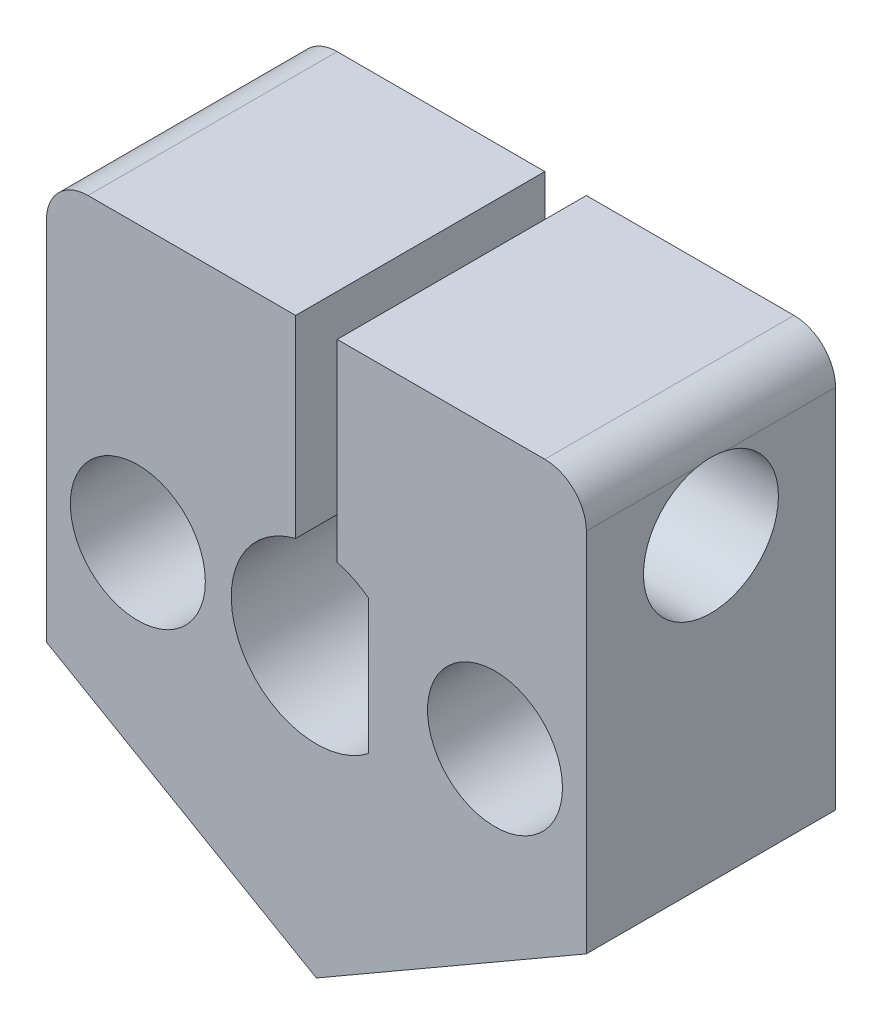
from build123d import *

# Parameters (mm, degrees)
BOSS_EXTRUDE1_DEPTH            = 12
SKETCH41_R                     = 1.7
CUT_EXTRUDE7_DEPTH             = 18
CBORE_FOR_M3_SHCS1_D           = 3.4
CBORE_FOR_M3_SHCS1_CBORE_D     = 6.5
CBORE_FOR_M3_SHCS1_CBORE_DEPTH = 3
F_3DSKETCH3_START              = 9
F_3DSKETCH3_OUTLINE_R          = 3.25
F_3DSKETCH3_OUTLINE_R_2        = 1.7
F_3DSKETCH3_DEPTH              = 3
CUT_EXTRUDE10_DEPTH            = 15
CUT_EXTRUDE10_DEPTH_BACK       = 15
SKETCH52_R                     = 1.7
SKETCH58_R                     = 3.25
CUT_EXTRUDE11_DEPTH            = 8
CUT_EXTRUDE12_DEPTH            = 4
CUT_EXTRUDE12_DEPTH_BACK       = 6
FILLET1_R                      = 2
SKETCH61_R                     = 3.25
CUT_EXTRUDE13_DEPTH            = 6
CUT_EXTRUDE14_DEPTH            = 1


# Read off the part's stored shape, not the designer's step: 3DSketch3
with BuildPart() as part:
    # Sketch1 → Boss-Extrude1 (new body)
    with BuildSketch(Plane(origin=(0, 0, 0), x_dir=(0, 1, 0), z_dir=(0, 0, 1))):
        with BuildLine():
            Line((-6.350852961, -13), (13.279056191, -13))
            Line((13.279056191, -13), (13.279056191, -1))
            Line((13.279056191, -1), (3.97617907, -1))
            ThreePointArc((3.97617907, -1), (3.68648689, -1.794384131), (3.24, -2.512449004))
            Line((3.24, -2.512449004), (-3.24, -2.512449004))
            ThreePointArc((-3.24, -2.512449004), (-3.879046275, -1.327780102), (-4.1, 0))
            ThreePointArc((-4.1, 0), (-0.503818326, 4.06892702), (3.97617907, 1))
            Line((3.97617907, 1), (13.279056191, 1))
            Line((13.279056191, 1), (13.279056191, 13))
            Line((13.279056191, 13), (-6.350852961, 13))
            Line((-6.350852961, 13), (-13.856406461, 0))
            Line((-13.856406461, 0), (-6.350852961, -13))
        make_face()
    extrude(amount=BOSS_EXTRUDE1_DEPTH)

    # Sketch41 → Cut-Extrude7 (cut)
    with BuildSketch(Plane(origin=(0, 0, 0), x_dir=(0, 1, 0), z_dir=(0, 0, 1))):
        with Locations(Location((0, 8.6, 0), (0, 0, 270))):
            Circle(SKETCH41_R)
        with Locations(Location((0, -8.6, 0), (0, 0, 270))):
            Circle(SKETCH41_R)
    extrude(amount=CUT_EXTRUDE7_DEPTH, mode=Mode.SUBTRACT)

    # CBORE for M3 SHCS1 (through all)
    with Locations(Plane(origin=(-8.6, 0, 12), x_dir=(1, 0, 0), z_dir=(0, 0, 1))):
        with Locations((0, 0)):
            CounterBoreHole(CBORE_FOR_M3_SHCS1_D / 2, CBORE_FOR_M3_SHCS1_CBORE_D / 2, CBORE_FOR_M3_SHCS1_CBORE_DEPTH)

    # 3DSketch3 outline → 3DSketch3 (cut)
    with BuildSketch(Plane.XY.offset(F_3DSKETCH3_START)):
        with Locations((8.6, 0)):
            Circle(F_3DSKETCH3_OUTLINE_R)
        with Locations((8.6, 0)):
            Circle(F_3DSKETCH3_OUTLINE_R_2, mode=Mode.SUBTRACT)
    extrude(amount=F_3DSKETCH3_DEPTH, mode=Mode.SUBTRACT)

    # Sketch52 → Cut-Extrude10 (cut, two sides: drawn at the far end of the back side and taken through both)
    with BuildSketch(Plane.YZ.offset(-1).offset(-CUT_EXTRUDE10_DEPTH_BACK)):
        with Locations((8.106406461, 6)):
            Circle(SKETCH52_R)
    extrude(amount=CUT_EXTRUDE10_DEPTH + CUT_EXTRUDE10_DEPTH_BACK, mode=Mode.SUBTRACT)

    # Sketch58 → Cut-Extrude11 (cut)
    with BuildSketch(Plane.YZ.offset(13)):
        with Locations(Location((8.106406461, 6, 0), (0, 0, 270))):
            Circle(SKETCH58_R)
    extrude(amount=-CUT_EXTRUDE11_DEPTH, mode=Mode.SUBTRACT)

    # Sketch60 → Cut-Extrude12 (cut, two sides: drawn at the far end of the back side and taken through both)
    with BuildSketch(Plane.YZ.offset(-8).offset(-CUT_EXTRUDE12_DEPTH_BACK)):
        Polygon((8.106406461, 2.709103466), (10.956406461, 4.354551733), (10.956406461, 7.645448267), (8.106406461, 9.290896534), (5.256406461, 7.645448267), (5.256406461, 4.354551733), align=None)
    extrude(amount=CUT_EXTRUDE12_DEPTH + CUT_EXTRUDE12_DEPTH_BACK, mode=Mode.SUBTRACT)

    # Fillet1
    # the kernel refuses this fillet: 2 mm, written as the material it takes off along each edge
    with BuildSketch(Plane(origin=(13, 13.279056191, -5), x_dir=(0, -1, 0), z_dir=(0, 0, 1)), Plane(origin=(-13, 13.279056191, -5), x_dir=(1, 0, 0), z_dir=(0, 0, 1))) as fillet1_piece_1:
        with BuildLine():
            CenterArc((FILLET1_R, -FILLET1_R), FILLET1_R, 90, 90)
            Line((0, -FILLET1_R), (0, 0))
            Line((0, 0), (FILLET1_R, 0))
        make_face()
    extrude(amount=22, mode=Mode.SUBTRACT)

    # Sketch61 → Cut-Extrude13 (cut)
    with BuildSketch(Plane(origin=(0, 0, 12), x_dir=(0, 1, 0), z_dir=(0, 0, 1))):
        with Locations(Location((0, 8.6, 0), (0, 0, 270))):
            Circle(SKETCH61_R)
        with Locations(Location((0, -8.6, 0), (0, 0, 270))):
            Circle(SKETCH61_R)
    extrude(amount=-CUT_EXTRUDE13_DEPTH, mode=Mode.SUBTRACT)

    # Sketch62 → Cut-Extrude14 (cut)
    with BuildSketch(Plane(origin=(-6, -10.392304845, 0), x_dir=(-0.8660254037844386, 0.5000000000000001, 0), z_dir=(-0.5000000000000001, -0.8660254037844386, 0))):
        Polygon((1.237336886, -6.103727624), (1.301138969, -6.103727624), (1.301138969, -8.526804547), (1.704985123, -8.526804547), (1.704985123, -8.885778906), (1.301138969, -8.885778906), (1.301138969, -9.693471213), (0.987036405, -9.693471213), (0.987036405, -8.885778906), (-0.673220005, -8.885778906), align=None)
        Polygon((0.987036405, -8.526804547), (0.987036405, -7.008174739), (-0.055531704, -8.526804547), align=None, mode=Mode.SUBTRACT)
    extrude(amount=-CUT_EXTRUDE14_DEPTH, mode=Mode.SUBTRACT)


solid = part.part
